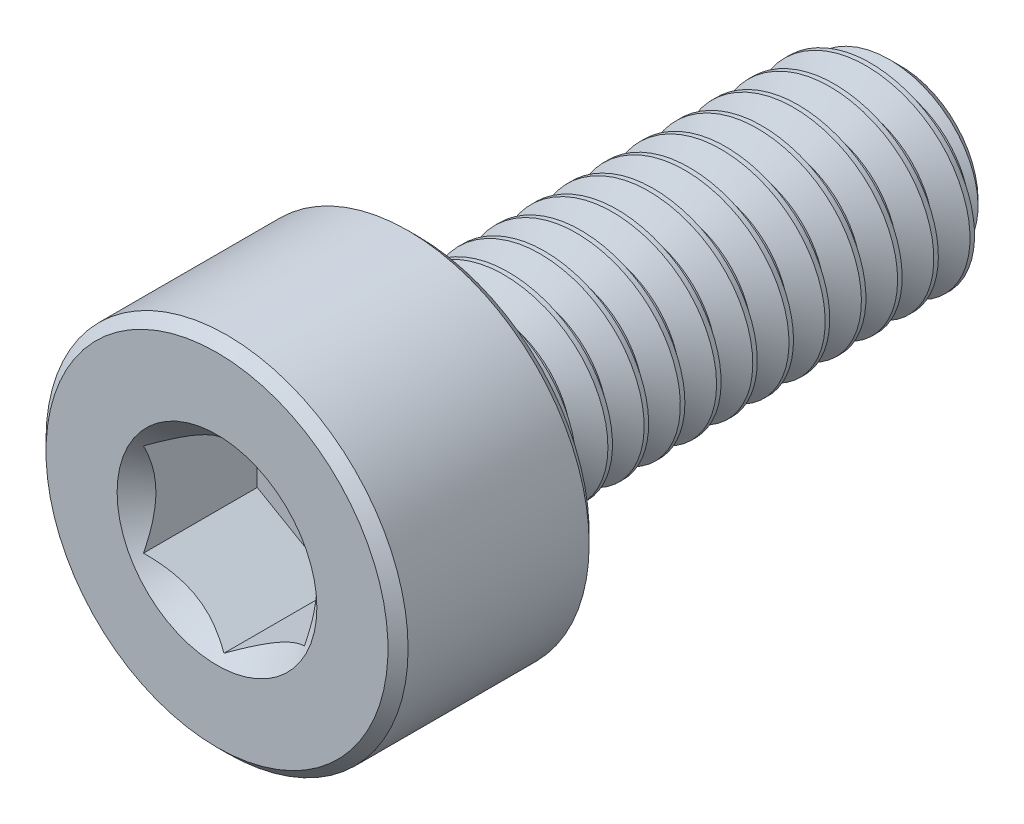
from build123d import *

# Parameters (mm, degrees)
CUT_EXTRUDE1_DEPTH     = 1.5
SPLIT1_SURFACE_1_BACK  = 11.618
SPLIT1_SURFACE_1_DEPTH = 23.236
SPLIT1_SURFACE_2_BACK  = 11.618
SPLIT1_SURFACE_2_DEPTH = 23.236
CUT_SWEEP1_PITCH       = 0.45


with BuildPart() as part:
    # Sketch2 → Revolve1 (revolve)
    with BuildSketch(Plane(origin=(0, 0, 0), x_dir=(0, 0, -1), z_dir=(1, 0, 0))):
        with BuildLine():
            Line((-4.25, 0), (-4.25, 2.125))
            Line((-4.25, 2.125), (-4.125, 2.25))
            Line((-4.125, 2.25), (-1.875, 2.25))
            Line((-1.875, 2.25), (-1.75, 2.125))
            Line((-1.75, 2.125), (-1.75, 1.375))
            ThreePointArc((-1.75, 1.375), (-1.713388348, 1.286611652), (-1.625, 1.25))
            Line((-1.625, 1.25), (3.957716426, 1.25))
            Line((3.957716426, 1.25), (4.25, 0.957716426))
            Line((4.25, 0.957716426), (4.25, 0))
            Line((4.25, 0), (-4.25, 0))
        make_face()
    revolve(axis=Axis((0, 0, -4.25), (0, 0, 1)))

    # Sketch3 → Cut-Extrude1 (cut)
    with BuildSketch(Plane.XY.offset(4.25)):
        Polygon((1, -0.577350269), (1, 0.577350269), (0, 1.154700538), (-1, 0.577350269), (-1, -0.577350269), (0, -1.154700538), align=None)
    extrude(amount=-CUT_EXTRUDE1_DEPTH, mode=Mode.SUBTRACT)

    # Cut-Extrude2 cone 1 section (through the dimple's axis) → Cut-Extrude2 (revolve, cut)
    with BuildSketch(Plane(origin=(0, 0, 4.25), x_dir=(0, -1, 0), z_dir=(1, 0, 0))):
        Polygon((0, 0), (1.241303079, 0), (0, 1.241303079), align=None)
    revolve(axis=Axis((0, 0, 4.25), (0, 0, -1)), mode=Mode.SUBTRACT)


with BuildPart() as body_2:
    # Split1: the piece behind the surface
    add(part.part)
    # Split1 surface: a surface, the sketch's curves swept straight by 23.236 mm
    with BuildLine(Plane(origin=(0, 0, 0), x_dir=(0, 0, -1), z_dir=(1, 0, 0)).offset(-SPLIT1_SURFACE_1_BACK), mode=Mode.PRIVATE) as split1_surface_1_path:
        Line((-1.625, -2.25), (-1.625, 2.25))
    split1_surface_1 = Shell.extrude(split1_surface_1_path.wire(), (1 * SPLIT1_SURFACE_1_DEPTH, 0 * SPLIT1_SURFACE_1_DEPTH, 0 * SPLIT1_SURFACE_1_DEPTH))
    split(bisect_by=split1_surface_1, keep=Keep.BOTTOM)

    # Cut-Sweep1: the profile of Sketch7 screwed along a right-hand helix of 14.333333 turns, 6 arcs to a turn; built about Z, then put on its axis
    cut_sweep1_z = Axis((0, 0, 0), (0, 0, 1))
    cut_sweep1_corners = [(1.274356964, 0, 0.0140625), (1.274356964, 0, -0.4078125), (0.957716426, 0, -0.225), (0.957716426, 0, -0.16875)]
    with BuildLine(mode=Mode.PRIVATE) as cut_sweep1_profile:
        Line(cut_sweep1_corners[0], cut_sweep1_corners[1])
        Line(cut_sweep1_corners[1], cut_sweep1_corners[2])
        Line(cut_sweep1_corners[2], cut_sweep1_corners[3])
        Line(cut_sweep1_corners[3], cut_sweep1_corners[0])
    cut_sweep1_cap = Face(cut_sweep1_profile.wire())
    cut_sweep1_turn_angles = [0, 30, 60, 90, 120, 150, 180, 210, 240, 270, 300, 330, 360]
    cut_sweep1_turn_weights = [1, 0.8660254037844387, 1, 0.8660254037844387, 1, 0.8660254037844387, 1, 0.8660254037844387, 1, 0.8660254037844387, 1, 0.8660254037844387, 1]
    cut_sweep1_turn_rails = [Edge.make_bspline([Vector(p[0], p[1], 0).rotate(cut_sweep1_z, cut_sweep1_turn_angles[k]) / cut_sweep1_turn_weights[k] + Vector(0, 0, p[2] + CUT_SWEEP1_PITCH * cut_sweep1_turn_angles[k] / 360) for k in range(13)], [0, 0, 0, 1, 1, 2, 2, 3, 3, 4, 4, 5, 5, 6, 6, 6], 2, cut_sweep1_turn_weights) for p in cut_sweep1_corners]
    cut_sweep1_turn_sides = [Face.make_surface_from_curves(cut_sweep1_turn_rails[p[0]], cut_sweep1_turn_rails[p[1]]) for p in [(0, 1), (1, 2), (2, 3), (3, 0)]]
    cut_sweep1_last_angles = [5040, 5070, 5100, 5130, 5160]
    cut_sweep1_last_weights = [1, 0.8660254037844387, 1, 0.8660254037844506, 1]
    cut_sweep1_last_rails = [Edge.make_bspline([Vector(p[0], p[1], 0).rotate(cut_sweep1_z, cut_sweep1_last_angles[k]) / cut_sweep1_last_weights[k] + Vector(0, 0, p[2] + CUT_SWEEP1_PITCH * cut_sweep1_last_angles[k] / 360) for k in range(5)], [0, 0, 0, 1, 1, 2, 2, 2], 2, cut_sweep1_last_weights) for p in cut_sweep1_corners]
    cut_sweep1_last_sides = [Face.make_surface_from_curves(cut_sweep1_last_rails[p[0]], cut_sweep1_last_rails[p[1]]) for p in [(0, 1), (1, 2), (2, 3), (3, 0)]]
    cut_sweep1 = Plane(origin=(0, 0, -4.25), x_dir=(0, 1, 0), z_dir=(0, 0, 1)) * Solid(Shell([*[p.moved(Location((0, 0, CUT_SWEEP1_PITCH * i))) for i in range(14) for p in cut_sweep1_turn_sides], *cut_sweep1_last_sides, cut_sweep1_cap, cut_sweep1_cap.rotate(cut_sweep1_z, 5160).moved(Location((0, 0, CUT_SWEEP1_PITCH * 5160 / 360)))]))
    add(cut_sweep1, mode=Mode.SUBTRACT)


with BuildPart() as part_1:
    add(part.part)

    # Split1: split by a surface, the side it looks to stays
    # Split1 surface: a surface, the sketch's curves swept straight by 23.236 mm
    with BuildLine(Plane(origin=(0, 0, 0), x_dir=(0, 0, -1), z_dir=(1, 0, 0)).offset(-SPLIT1_SURFACE_2_BACK), mode=Mode.PRIVATE) as split1_surface_2_path:
        Line((-1.625, -2.25), (-1.625, 2.25))
    split1_surface_2 = Shell.extrude(split1_surface_2_path.wire(), (1 * SPLIT1_SURFACE_2_DEPTH, 0 * SPLIT1_SURFACE_2_DEPTH, 0 * SPLIT1_SURFACE_2_DEPTH))
    split(bisect_by=split1_surface_2, keep=Keep.TOP)

    add(body_2.part)  # Revolve2 merges body 2
    # Sketch8 → Revolve2 (revolve)
    with BuildSketch(Plane(origin=(0, 0, 0), x_dir=(0, 0, -1), z_dir=(1, 0, 0)), mode=Mode.PRIVATE) as revolve2_sk:
        Polygon((-1.75, 0), (-1.75, 1.25), (-1.625, 1.25), (-0.903312164, 0), align=None)
    revolve(revolve2_sk.sketch.rotate(Axis((0, 0, 0.903312164), (0, 0, 1)), 270), axis=Axis((0, 0, 0.903312164), (0, 0, 1)))


solid = part_1.part
